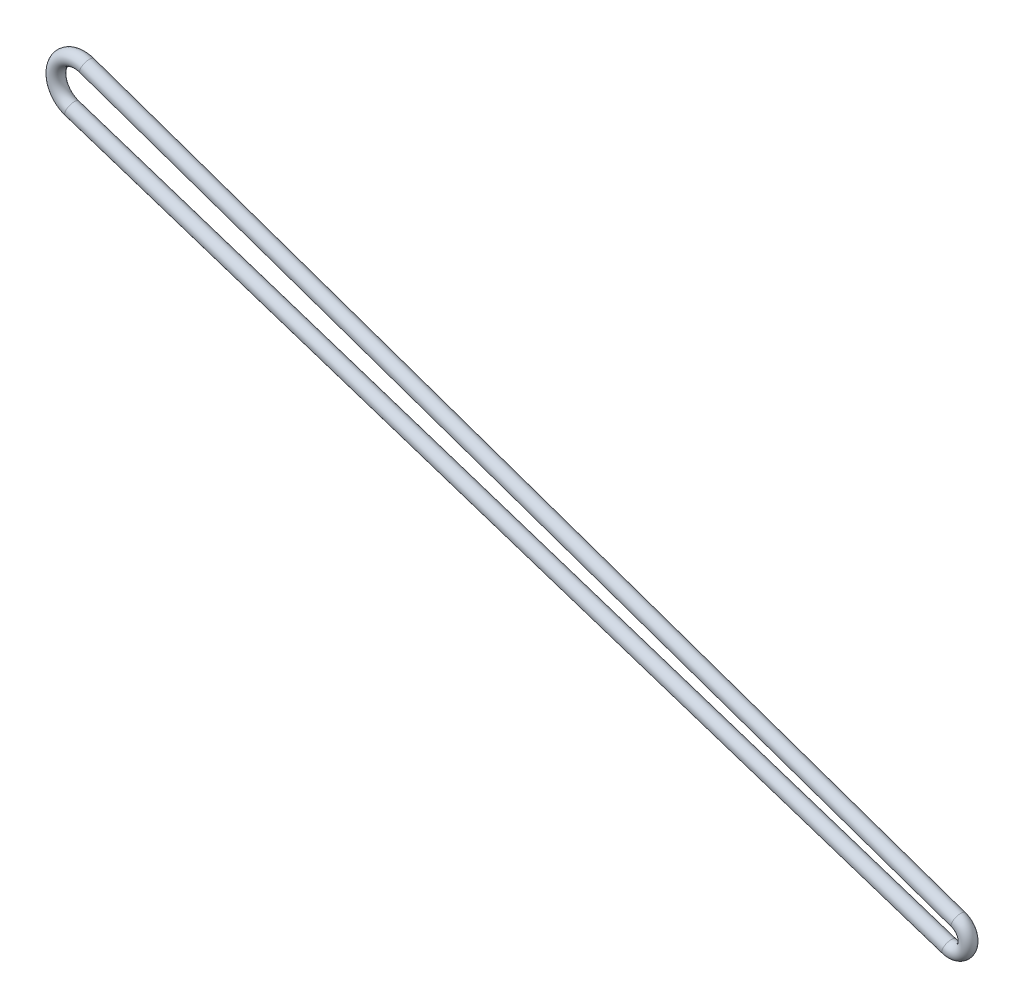
from build123d import *

# Parameters (mm, degrees)
SWEEP_19_PROFILE_R = 1.5


with BuildPart() as part:
    # 扫描19: sweep along a path in 草图2
    with BuildLine(Plane.XY) as sweep_19_path:
        Line((293.972235021, 75.042391422), (106.518070042, 136.394059751))
        ThreePointArc((106.518070042, 136.394059751), (103.336573494, 142.746988788), (109.719853726, 145.86714281))
        Line((109.719853726, 145.86714281), (295.957340905, 80.915702918))
        ThreePointArc((295.957340905, 80.915702918), (297.873291157, 76.99600944), (293.972235021, 75.042391422))
    # 扫描19 profile (on start of the path) → 扫描19 (sweep)
    with BuildSketch(Plane(origin=(293.972235021, 75.042391422, 0), x_dir=(-0.31105294780048276, -0.9503925839697143, 0), z_dir=(-0.9503925839697143, 0.31105294780048276, 0))):
        Circle(SWEEP_19_PROFILE_R)
    sweep(path=sweep_19_path.line)


solid = part.part
